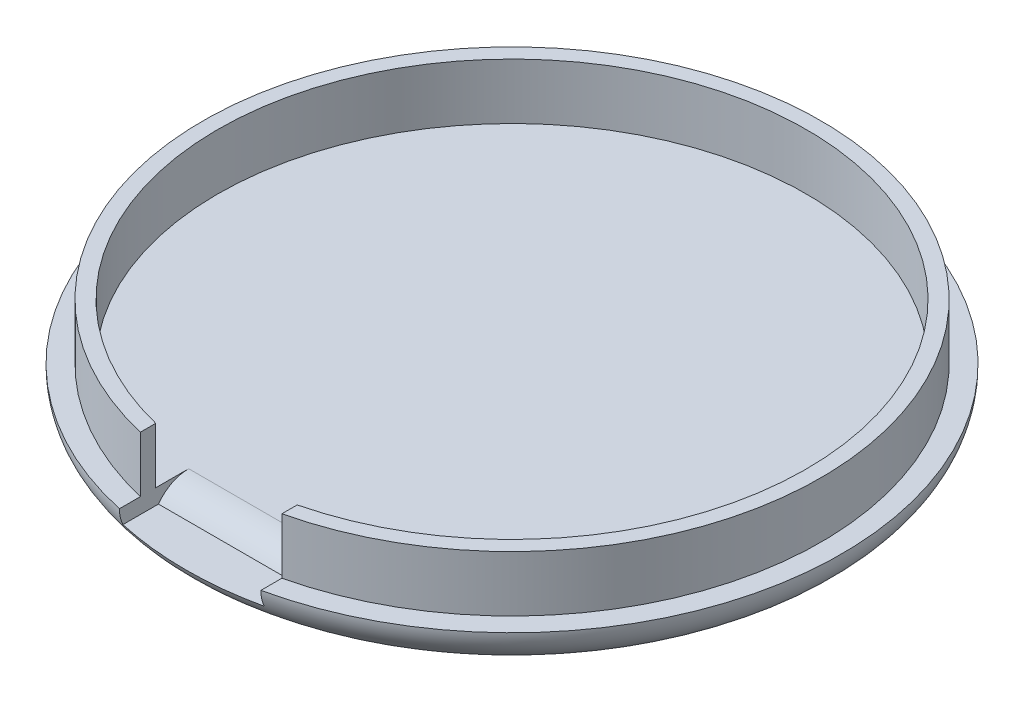
from build123d import *

# Parameters (mm, degrees)
SKETCH1_R           = 17.71
BOSS_EXTRUDE1_DEPTH = 2
SKETCH1_3_R         = 16.61
SKETCH1_3_R_2       = 15.81
BOSS_EXTRUDE2_DEPTH = 5
FILLET1_R           = 2
SKETCH3_W           = 7.599801802
SKETCH3_H           = 7.043482716
CUT_EXTRUDE1_DEPTH  = 4.8
FILLET2_R           = 2


# Some blends are built 0.0001 mm under size
with BuildPart() as part:
    # Sketch1 → Boss-Extrude1 (new body)
    with BuildSketch(Plane(origin=(0, 0, 0), x_dir=(1, 0, 0), z_dir=(0, 1, 0))):
        with Locations(Location((0, 0, 0), (0, 0, 270))):
            Circle(SKETCH1_R)
    extrude(amount=BOSS_EXTRUDE1_DEPTH)

    # Sketch1<3> → Boss-Extrude2 (add)
    with BuildSketch(Plane(origin=(0, 0, 0), x_dir=(1, 0, 0), z_dir=(0, 1, 0))):
        with Locations(Location((0, 0, 0), (0, 0, 270))):
            Circle(SKETCH1_3_R)
        with Locations(Location((0, 0, 0), (0, 0, 270))):
            Circle(SKETCH1_3_R_2, mode=Mode.SUBTRACT)
    extrude(amount=BOSS_EXTRUDE2_DEPTH)

    # Fillet1
    fillet1_edges = [part.edges().sort_by_distance(p)[0] for p in [
        (0, 0, -17.71),
    ]]
    fillet(fillet1_edges, radius=FILLET1_R - 0.0001)  # a hair under: the kernel refuses the full size

    # Sketch3 → Cut-Extrude1 (cut)
    with BuildSketch(Plane.XY.offset(20)):
        with Locations((0, 4.688271449)):
            Rectangle(SKETCH3_W, SKETCH3_H)
    extrude(amount=-CUT_EXTRUDE1_DEPTH, mode=Mode.SUBTRACT)

    # Fillet2
    # the kernel refuses this fillet: 2 mm, written as the material it takes off along each edge
    with BuildSketch(Plane(origin=(3.799900901, 2, 15.2), x_dir=(0, 0, -1), z_dir=(-1, 0, 0))) as fillet2_piece_1:
        with BuildLine():
            CenterArc((1.624563802, 2), FILLET2_R, 215.680517758, 54.319482242)
            Line((0, 0.833469909), (-0.032491276, 0.810139307))
            ThreePointArc((-0.032491276, 0.810139307), (-0.04, 0.416734955), (-0.04, 0))
            Line((-0.04, 0), (0, -0.04))
            Line((0, -0.04), (1.624563802, -0.04))
            Line((1.624563802, -0.04), (1.624563802, 0))
        make_face()
    extrude(amount=7.599801803, mode=Mode.SUBTRACT)


solid = part.part
